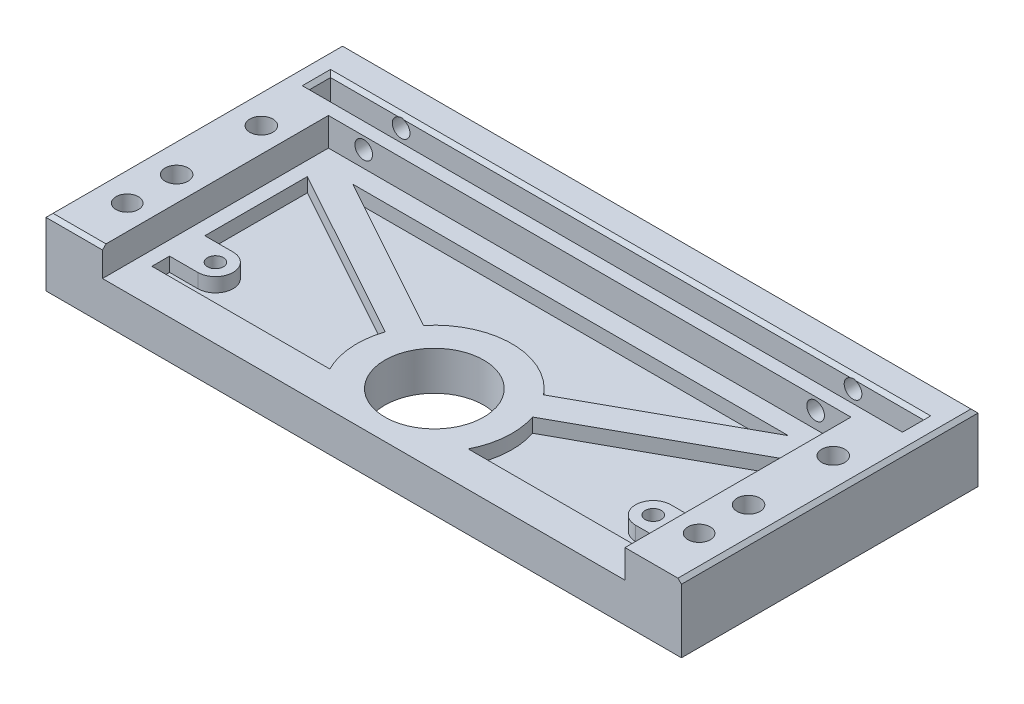
from build123d import *

# Parameters (mm, degrees)
SKETCH1_W               = 90
SKETCH1_H               = 9.525
SKETCH1_R               = 2
BOSS_EXTRUDE1_DEPTH     = 45
SKETCH2_R               = 7
CUT_EXTRUDE2_DEPTH      = 10
SKETCH3_R               = 1.63195
SKETCH3_R_2             = 7
SKETCH3_R_3             = 1.1303
CUT_EXTRUDE3_DEPTH      = 10
SKETCH4_W               = 84
SKETCH4_H               = 3
CUT_EXTRUDE4_DEPTH      = 6
CUT_EXTRUDE6_DEPTH      = 102.072872844
CUT_EXTRUDE6_DEPTH_BACK = 6
SKETCH7_W               = 90
SKETCH7_H               = 3
CUT_EXTRUDE7_DEPTH      = 10
SKETCH9_W               = 74
SKETCH9_H               = 32
CUT_EXTRUDE8_DEPTH      = 4
CUT_EXTRUDE9_REACH      = 97.993
SKETCH10_R              = 1.25
CHAMFER2_SIZE           = 0.5
SKETCH11_R              = 1.5875
CUT_EXTRUDE10_DEPTH     = 4


with BuildPart() as part:
    # Sketch1 → Boss-Extrude1 (new body)
    # profile 1 of 3: a face of its own
    with BuildSketch(Plane.XY):
        with Locations((45, 4.7625)):
            Rectangle(SKETCH1_W, SKETCH1_H)
        with Locations((60, 4.7625)):
            Circle(SKETCH1_R, mode=Mode.SUBTRACT)
        with Locations((30, 4.7625)):
            Circle(SKETCH1_R, mode=Mode.SUBTRACT)
    # profile 2 of 3: a face of its own
    with BuildSketch(Plane.XY):
        with Locations((30, 4.7625)):
            Circle(SKETCH1_R)
    # profile 3 of 3: a face of its own
    with BuildSketch(Plane.XY):
        with Locations((60, 4.7625)):
            Circle(SKETCH1_R)
    extrude(amount=BOSS_EXTRUDE1_DEPTH)

    # Sketch2 → Cut-Extrude2 (cut)
    with BuildSketch(Plane(origin=(0, 9.525, 0), x_dir=(1, 0, 0), z_dir=(0, 1, 0))):
        with Locations(Location((45, -35, 0), (0, 0, 270))):
            Circle(SKETCH2_R)
    extrude(amount=-CUT_EXTRUDE2_DEPTH, mode=Mode.SUBTRACT)

    # Sketch3 → Cut-Extrude3 (cut)
    with BuildSketch(Plane(origin=(0, 9.525, 0), x_dir=(1, 0, 0), z_dir=(0, 1, 0))):
        with Locations(Location((85.5, -31, 0), (0, 0, 270))):
            Circle(SKETCH3_R)
        with Locations(Location((4.5, -31, 0), (0, 0, 270))):
            Circle(SKETCH3_R)
        with Locations(Location((45, -35, 0), (0, 0, 270))):
            Circle(SKETCH3_R_2)
        with Locations(Location((85.5, -19, 0), (0, 0, 270))):
            Circle(SKETCH3_R)
        with Locations(Location((4.5, -19, 0), (0, 0, 270))):
            Circle(SKETCH3_R)
        with Locations(Location((76, -35, 0), (0, 0, 270))):
            Circle(SKETCH3_R_3)
        with Locations(Location((14, -35, 0), (0, 0, 270))):
            Circle(SKETCH3_R_3)
    extrude(amount=-CUT_EXTRUDE3_DEPTH, mode=Mode.SUBTRACT)

    # Sketch4 → Cut-Extrude4 (cut)
    with BuildSketch(Plane(origin=(0, 9.525, 0), x_dir=(1, 0, 0), z_dir=(0, 1, 0))):
        with Locations((45, -9.2)):
            Rectangle(SKETCH4_W, SKETCH4_H)
    extrude(amount=-CUT_EXTRUDE4_DEPTH, mode=Mode.SUBTRACT)

    # Sketch6 → Cut-Extrude6 (cut, two sides: drawn at the far end of the back side and taken through both)
    with BuildSketch(Plane(origin=(0, 9.525, 0), x_dir=(1, 0, 0), z_dir=(0, 1, 0)).offset(-CUT_EXTRUDE6_DEPTH_BACK)):
        with BuildLine():
            ThreePointArc((14, -32.5), (16.5, -35), (14, -37.5))
            Line((14, -37.5), (10, -37.5))
            Line((10, -37.5), (10, -40))
            Line((10, -40), (35.202041029, -40))
            ThreePointArc((35.202041029, -40), (34.031236019, -35.828381989), (34.562237569, -31.528240298))
            Line((34.562237569, -31.528240298), (10, -17.983920725))
            Line((10, -17.983920725), (10, -32.5))
            Line((10, -32.5), (14, -32.5))
        make_face()
        with BuildLine():
            Line((14.141825149, -15.7), (36.493753196, -28.025491752))
            ThreePointArc((36.493753196, -28.025491752), (45, -24), (53.506246804, -28.025491752))
            Line((53.506246804, -28.025491752), (75.858174851, -15.7))
            Line((75.858174851, -15.7), (14.141825149, -15.7))
        make_face()
        with BuildLine():
            ThreePointArc((55.437762431, -31.528240298), (55.968763981, -35.828381989), (54.797958971, -40))
            Line((54.797958971, -40), (80, -40))
            Line((80, -40), (80, -37.5))
            Line((80, -37.5), (76, -37.5))
            ThreePointArc((76, -37.5), (73.5, -35), (76, -32.5))
            Line((76, -32.5), (80, -32.5))
            Line((80, -32.5), (80, -17.983920725))
            Line((80, -17.983920725), (55.437762431, -31.528240298))
        make_face()
    extrude(amount=CUT_EXTRUDE6_DEPTH + CUT_EXTRUDE6_DEPTH_BACK, mode=Mode.SUBTRACT)

    # Sketch7 → Cut-Extrude7 (cut)
    with BuildSketch(Plane(origin=(0, 9.525, 0), x_dir=(1, 0, 0), z_dir=(0, 1, 0))):
        with Locations((45, -1.5)):
            Rectangle(SKETCH7_W, SKETCH7_H)
    extrude(amount=-CUT_EXTRUDE7_DEPTH, mode=Mode.SUBTRACT)

    # Sketch9 → Cut-Extrude8 (cut)
    with BuildSketch(Plane(origin=(0, 9.525, 0), x_dir=(1, 0, 0), z_dir=(0, 1, 0))):
        with Locations((45, -29)):
            Rectangle(SKETCH9_W, SKETCH9_H)
    extrude(amount=-CUT_EXTRUDE8_DEPTH, mode=Mode.SUBTRACT)

    # Cut-Extrude9: up to this face of the body (flat: up to its plane)
    cut_extrude9_end = Plane(part.part.faces().sort_by_distance((45, 4.7625, 3))[0])
    # Sketch10 → Cut-Extrude9 (cut, up to the picked face)
    with BuildSketch(Plane.XY.offset(13), mode=Mode.PRIVATE) as cut_extrude9_sk1:
        with Locations((77, 7.825)):
            Circle(SKETCH10_R)
    cut_extrude9_tool1 = split(extrude(cut_extrude9_sk1.sketch, amount=-CUT_EXTRUDE9_REACH, mode=Mode.PRIVATE), bisect_by=cut_extrude9_end, keep=Keep.BOTH, mode=Mode.PRIVATE)
    # Sketch10 → Cut-Extrude9 (cut, up to the picked face)
    with BuildSketch(Plane.XY.offset(13), mode=Mode.PRIVATE) as cut_extrude9_sk2:
        with Locations((13, 7.825)):
            Circle(SKETCH10_R)
    cut_extrude9_tool2 = split(extrude(cut_extrude9_sk2.sketch, amount=-CUT_EXTRUDE9_REACH, mode=Mode.PRIVATE), bisect_by=cut_extrude9_end, keep=Keep.BOTH, mode=Mode.PRIVATE)
    add(cut_extrude9_tool1.solids().sort_by(Axis((77, 7.825, 13), (0, 0, -1)))[0], mode=Mode.SUBTRACT)
    add(cut_extrude9_tool2.solids().sort_by(Axis((13, 7.825, 13), (0, 0, -1)))[0], mode=Mode.SUBTRACT)

    # Chamfer2
    # the kernel refuses this chamfer: 0.5 mm, written as the material it takes off along each edge
    with BuildSketch(Plane(origin=(9.285841494, 9.525, 45), x_dir=(0, -0.999621916911297, 0.0274958766105822), z_dir=(-1, 0, 0))) as chamfer2_piece_1:
        Polygon((CHAMFER2_SIZE * 0.999621916911, -CHAMFER2_SIZE * 0.0274958766106), (-CHAMFER2_SIZE * 0.0274958766106, -CHAMFER2_SIZE * 0.999621916911), (0, 0), align=None)
    extrude(amount=10.571682988, mode=Mode.SUBTRACT)
    with BuildSketch(Plane(origin=(-1.285841494, 9.525, 3), x_dir=(0, -0.9996219169112968, -0.02749587661058651), z_dir=(1, 0, 0))) as chamfer2_piece_2:
        Polygon((CHAMFER2_SIZE * 0.999621916911, -CHAMFER2_SIZE * 0.0274958766106), (-CHAMFER2_SIZE * 0.0274958766106, -CHAMFER2_SIZE * 0.999621916911), (0, 0), align=None)
    extrude(amount=92.571682988, mode=Mode.SUBTRACT)
    with BuildSketch(Plane(origin=(87, 9.525, 10.7), x_dir=(0.999621916911297, 0.027495876610582292, 0), z_dir=(0, 0, -1)), Plane(origin=(3, 9.525, 7.7), x_dir=(-0.9996219169112968, 0.027495876610585408, -1.1837901526131803e-15), z_dir=(0, 0, 1))) as chamfer2_piece_3:
        Polygon((CHAMFER2_SIZE * 0.999621916911, CHAMFER2_SIZE * 0.0274958766106), (-CHAMFER2_SIZE * 0.0274958766106, CHAMFER2_SIZE * 0.999621916911), (0, 0), align=None)
    extrude(amount=3, mode=Mode.SUBTRACT)
    with BuildSketch(Plane(origin=(87, 9.525, 7.7), x_dir=(0, 0.0274958766105822, -0.999621916911297), z_dir=(-1, 0, 0)), Plane(origin=(3, 9.525, 10.7), x_dir=(0, 0.027495876610585647, 0.9996219169112968), z_dir=(1, 0, 0))) as chamfer2_piece_4:
        Polygon((CHAMFER2_SIZE * 0.999621916911, CHAMFER2_SIZE * 0.0274958766106), (-CHAMFER2_SIZE * 0.0274958766106, CHAMFER2_SIZE * 0.999621916911), (0, 0), align=None)
    extrude(amount=84, mode=Mode.SUBTRACT)
    with BuildSketch(Plane(origin=(0, 9.525, 1.714158506), x_dir=(-0.02749587661058639, -0.9996219169112968, 0), z_dir=(0, 0, 1))) as chamfer2_piece_5:
        Polygon((CHAMFER2_SIZE * 0.999621916911, CHAMFER2_SIZE * 0.0274958766106), (-CHAMFER2_SIZE * 0.0274958766106, CHAMFER2_SIZE * 0.999621916911), (0, 0), align=None)
    extrude(amount=44.571682988, mode=Mode.SUBTRACT)
    with BuildSketch(Plane(origin=(90, 9.525, 1.714158506), x_dir=(0.0274958766105822, -0.999621916911297, 0), z_dir=(0, 0, 1))) as chamfer2_piece_6:
        Polygon((CHAMFER2_SIZE * 0.999621916911, -CHAMFER2_SIZE * 0.0274958766106), (-CHAMFER2_SIZE * 0.0274958766106, -CHAMFER2_SIZE * 0.999621916911), (0, 0), align=None)
    extrude(amount=44.571682988, mode=Mode.SUBTRACT)
    with BuildSketch(Plane(origin=(87, 9.525, 11.985841494), x_dir=(0.9996219169112968, 0.02749587661058574, 0), z_dir=(0, 0, -1))) as chamfer2_piece_7a_section:
        Polygon((CHAMFER2_SIZE * 0.999621916911, CHAMFER2_SIZE * 0.0274958766106), (-CHAMFER2_SIZE * 0.0274958766106, CHAMFER2_SIZE * 0.999621916911), (0, 0), align=None)
    chamfer2_piece_7a = extrude(amount=4.285841494, mode=Mode.PRIVATE)
    chamfer2_piece_7a = split(chamfer2_piece_7a, bisect_by=Plane(origin=(87.164896813, 9.360103187, 10.7), z_dir=(0, 0, 1)), keep=Keep.TOP, mode=Mode.PRIVATE)
    with BuildSketch(Plane(origin=(3, 9.525, 10.7), x_dir=(0, 0.027495876610585647, 0.9996219169112968), z_dir=(1, 0, 0))) as chamfer2_piece_7b_section:
        Polygon((CHAMFER2_SIZE * 0.999621916911, CHAMFER2_SIZE * 0.0274958766106), (-CHAMFER2_SIZE * 0.0274958766106, CHAMFER2_SIZE * 0.999621916911), (0, 0), align=None)
    chamfer2_piece_7b = extrude(amount=85.285841494, mode=Mode.PRIVATE)
    chamfer2_piece_7b = split(chamfer2_piece_7b, bisect_by=Plane(origin=(87, 9.360103187, 10.864896813), z_dir=(1, 0, 0)), keep=Keep.TOP, mode=Mode.PRIVATE)
    chamfer2_piece_7 = chamfer2_piece_7a & chamfer2_piece_7b
    add(chamfer2_piece_7, mode=Mode.SUBTRACT)
    with BuildSketch(Plane(origin=(87, 9.525, 10.7), x_dir=(0.999621916911297, 0.027495876610582292, 0), z_dir=(0, 0, -1))) as chamfer2_piece_8a_section:
        Polygon((CHAMFER2_SIZE * 0.999621916911, CHAMFER2_SIZE * 0.0274958766106), (-CHAMFER2_SIZE * 0.0274958766106, CHAMFER2_SIZE * 0.999621916911), (0, 0), align=None)
    chamfer2_piece_8a = extrude(amount=4.285841494, mode=Mode.PRIVATE)
    chamfer2_piece_8a = split(chamfer2_piece_8a, bisect_by=Plane(origin=(87.164896813, 9.360103187, 7.7), z_dir=(0, 0, -1)), keep=Keep.TOP, mode=Mode.PRIVATE)
    with BuildSketch(Plane(origin=(88.285841494, 9.525, 7.7), x_dir=(0, 0.027495876610585647, -0.9996219169112968), z_dir=(-1, 0, 0))) as chamfer2_piece_8b_section:
        Polygon((CHAMFER2_SIZE * 0.999621916911, CHAMFER2_SIZE * 0.0274958766106), (-CHAMFER2_SIZE * 0.0274958766106, CHAMFER2_SIZE * 0.999621916911), (0, 0), align=None)
    chamfer2_piece_8b = extrude(amount=85.285841494, mode=Mode.PRIVATE)
    chamfer2_piece_8b = split(chamfer2_piece_8b, bisect_by=Plane(origin=(87, 9.360103187, 7.535103187), z_dir=(1, 0, 0)), keep=Keep.TOP, mode=Mode.PRIVATE)
    chamfer2_piece_8 = chamfer2_piece_8a & chamfer2_piece_8b
    add(chamfer2_piece_8, mode=Mode.SUBTRACT)
    with BuildSketch(Plane(origin=(87, 9.525, 7.7), x_dir=(0, 0.0274958766105822, -0.999621916911297), z_dir=(-1, 0, 0))) as chamfer2_piece_9a_section:
        Polygon((CHAMFER2_SIZE * 0.999621916911, CHAMFER2_SIZE * 0.0274958766106), (-CHAMFER2_SIZE * 0.0274958766106, CHAMFER2_SIZE * 0.999621916911), (0, 0), align=None)
    chamfer2_piece_9a = extrude(amount=85.285841494, mode=Mode.PRIVATE)
    chamfer2_piece_9a = split(chamfer2_piece_9a, bisect_by=Plane(origin=(3, 9.360103187, 7.535103187), z_dir=(-1, 0, 0)), keep=Keep.TOP, mode=Mode.PRIVATE)
    with BuildSketch(Plane(origin=(3, 9.525, 6.414158506), x_dir=(-0.9996219169112968, 0.027495876610585623, -1.1837901526131803e-15), z_dir=(0, 0, 1))) as chamfer2_piece_9b_section:
        Polygon((CHAMFER2_SIZE * 0.999621916911, CHAMFER2_SIZE * 0.0274958766106), (-CHAMFER2_SIZE * 0.0274958766106, CHAMFER2_SIZE * 0.999621916911), (0, 0), align=None)
    chamfer2_piece_9b = extrude(amount=4.285841494, mode=Mode.PRIVATE)
    chamfer2_piece_9b = split(chamfer2_piece_9b, bisect_by=Plane(origin=(2.835103187, 9.360103187, 7.7), z_dir=(0, 0, -1)), keep=Keep.TOP, mode=Mode.PRIVATE)
    chamfer2_piece_9 = chamfer2_piece_9a & chamfer2_piece_9b
    add(chamfer2_piece_9, mode=Mode.SUBTRACT)
    with BuildSketch(Plane(origin=(1.714158506, 9.525, 10.7), x_dir=(0, 0.027495876610585647, 0.9996219169112968), z_dir=(1, 0, 0))) as chamfer2_piece_10a_section:
        Polygon((CHAMFER2_SIZE * 0.999621916911, CHAMFER2_SIZE * 0.0274958766106), (-CHAMFER2_SIZE * 0.0274958766106, CHAMFER2_SIZE * 0.999621916911), (0, 0), align=None)
    chamfer2_piece_10a = extrude(amount=85.285841494, mode=Mode.PRIVATE)
    chamfer2_piece_10a = split(chamfer2_piece_10a, bisect_by=Plane(origin=(3, 9.360103187, 10.864896813), z_dir=(-1, 0, 0)), keep=Keep.TOP, mode=Mode.PRIVATE)
    with BuildSketch(Plane(origin=(3, 9.525, 7.7), x_dir=(-0.9996219169112968, 0.027495876610585408, -1.1837901526131803e-15), z_dir=(0, 0, 1))) as chamfer2_piece_10b_section:
        Polygon((CHAMFER2_SIZE * 0.999621916911, CHAMFER2_SIZE * 0.0274958766106), (-CHAMFER2_SIZE * 0.0274958766106, CHAMFER2_SIZE * 0.999621916911), (0, 0), align=None)
    chamfer2_piece_10b = extrude(amount=4.285841494, mode=Mode.PRIVATE)
    chamfer2_piece_10b = split(chamfer2_piece_10b, bisect_by=Plane(origin=(2.835103187, 9.360103187, 10.7), z_dir=(0, 0, 1)), keep=Keep.TOP, mode=Mode.PRIVATE)
    chamfer2_piece_10 = chamfer2_piece_10a & chamfer2_piece_10b
    add(chamfer2_piece_10, mode=Mode.SUBTRACT)

    # Sketch11 → Cut-Extrude10 (cut)
    with BuildSketch(Plane(origin=(0, 9.525, 0), x_dir=(1, 0, 0), z_dir=(0, 1, 0))):
        with Locations(Location((85.5, -38, 0), (0, 0, 180))):
            Circle(SKETCH11_R)
        with Locations(Location((4.5, -38, 0), (0, 0, 180))):
            Circle(SKETCH11_R)
    extrude(amount=-CUT_EXTRUDE10_DEPTH, mode=Mode.SUBTRACT)


solid = part.part
